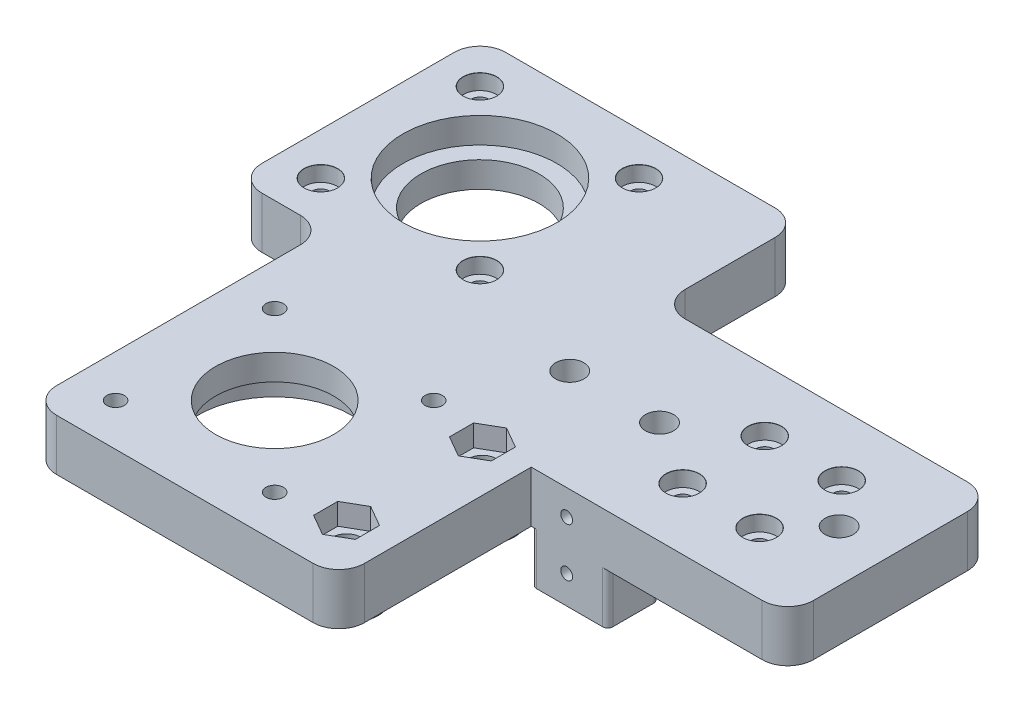
from build123d import *

# Parameters (mm, degrees)
BOSS_EXTRUDE1_DEPTH            = 10
FILLET1_R                      = 5
SKETCH3_R                      = 11.5
CUT_EXTRUDE1_DEPTH             = 10
CBORE_FOR_M3_SHCS1_AT_2_COUNT  = 2
CBORE_FOR_M3_SHCS1_AT_2_PITCH  = 43.840620434
CBORE_FOR_M3_SHCS1_AT_3_COUNT  = 2
CBORE_FOR_M3_SHCS1_AT_3_PITCH  = 31
CBORE_FOR_M3_SHCS1_AT_4_COUNT  = 2
CBORE_FOR_M3_SHCS1_AT_4_PITCH  = 31
CBORE_FOR_M3_SHCS2_AT_2_COUNT  = 2
CBORE_FOR_M3_SHCS2_AT_2_PITCH  = 15
CBORE_FOR_M3_SHCS2_AT_3_COUNT  = 2
CBORE_FOR_M3_SHCS2_AT_3_PITCH  = 21.931712199
CBORE_FOR_M3_SHCS2_AT_4_COUNT  = 2
CBORE_FOR_M3_SHCS2_AT_4_PITCH  = 16
CBORE_FOR_M5_SHCS1_AT_2_COUNT  = 2
CBORE_FOR_M5_SHCS1_AT_2_PITCH  = 35
CBORE_FOR_M5_SHCS1_AT_3_COUNT  = 2
CBORE_FOR_M5_SHCS1_AT_3_PITCH  = 52.5
BOSS_EXTRUDE2_DEPTH            = 10
CUT_EXTRUDE2_DEPTH             = 10
FILLET2_R                      = 5
SKETCH16_R                     = 11.5
CUT_EXTRUDE3_DEPTH             = 125.524094054
CBORE_FOR_M3_SHCS3_AT_2_COUNT  = 2
CBORE_FOR_M3_SHCS3_AT_2_PITCH  = 31
CBORE_FOR_M3_SHCS3_AT_3_COUNT  = 2
CBORE_FOR_M3_SHCS3_AT_3_PITCH  = 43.840620434
CBORE_FOR_M3_SHCS3_AT_4_COUNT  = 2
CBORE_FOR_M3_SHCS3_AT_4_PITCH  = 31
CUT_EXTRUDE4_DEPTH             = 4.2
M5_CLEARANCE_HOLE1_D           = 5.5
M5_CLEARANCE_HOLE1_CSINK_D     = 5.55
M5_CLEARANCE_HOLE1_CSINK_ANGLE = 90
SKETCH24_R                     = 15
CUT_EXTRUDE5_DEPTH             = 5
SKETCH25_R                     = 15
CUT_EXTRUDE6_DEPTH             = 5
BOSS_EXTRUDE3_START            = 2.9
SKETCH26_R                     = 6.25
SKETCH26_R_2                   = 2.75
BOSS_EXTRUDE3_DEPTH            = 2.9
CUT_EXTRUDE7_DEPTH             = 10
FILLET3_R                      = 5
SKETCH28_W                     = 14.9
SKETCH28_H                     = 10
BOSS_EXTRUDE4_DEPTH            = 10
SKETCH29_R                     = 1.15
CUT_EXTRUDE8_DEPTH             = 5
FILLET4_R                      = 1


with BuildPart() as part:
    # Sketch1 → Boss-Extrude1 (new body)
    with BuildSketch(Plane(origin=(0, 0, 0), x_dir=(1, 0, 0), z_dir=(0, 1, 0))):
        Polygon((0, 67.5), (0, -47.5), (60, -47.5), (60, -10), (110, -10), (110, 30), (60, 30), (60, 67.5), align=None)
    extrude(amount=BOSS_EXTRUDE1_DEPTH)

    # Fillet1
    fillet1_edges = [part.edges().sort_by_distance(p)[0] for p in [
        (60, 5, -30),
        (110, 5, -30),
        (110, 5, 10),
        (0, 5, 47.5),
        (0, 5, -67.5),
        (60, 5, -67.5),
        (60, 5, 47.5),
    ]]
    fillet(fillet1_edges, radius=FILLET1_R)

    # Sketch3 → Cut-Extrude1 (cut)
    with BuildSketch(Plane(origin=(0, 10, 0), x_dir=(1, 0, 0), z_dir=(0, 1, 0))):
        with Locations((23.75, -23.75)):
            Circle(SKETCH3_R)
    extrude(amount=-CUT_EXTRUDE1_DEPTH, mode=Mode.SUBTRACT)

    # Sketch6 → CBORE for M3 SHCS1 (revolve, cut)
    with BuildSketch(Plane(origin=(39.25, 0, 8.25), x_dir=(0, 0, -1), z_dir=(1, 0, 0))):
        Polygon((0, 0), (0, 10), (1.7, 10), (1.7, 3), (3.25, 3), (3.25, 0.025), (3.275, 0), align=None)
    cbore_for_m3_shcs1 = revolve(axis=Axis((39.25, -6.35, 8.25), (0, 1, 0)), mode=Mode.SUBTRACT)

    # CBORE for M3 SHCS1 at 2: CBORE for M3 SHCS1 ×2
    with Locations(*[Vector(-0.7071067811865478, 0, 0.7071067811865474) * (i * CBORE_FOR_M3_SHCS1_AT_2_PITCH) for i in range(1, CBORE_FOR_M3_SHCS1_AT_2_COUNT)]):
        add(cbore_for_m3_shcs1, mode=Mode.SUBTRACT)

    # CBORE for M3 SHCS1 at 3: CBORE for M3 SHCS1 ×2
    with Locations(*[(-i * CBORE_FOR_M3_SHCS1_AT_3_PITCH, 0, 0) for i in range(1, CBORE_FOR_M3_SHCS1_AT_3_COUNT)]):
        add(cbore_for_m3_shcs1, mode=Mode.SUBTRACT)

    # CBORE for M3 SHCS1 at 4: CBORE for M3 SHCS1 ×2
    with Locations(*[(0, 0, i * CBORE_FOR_M3_SHCS1_AT_4_PITCH) for i in range(1, CBORE_FOR_M3_SHCS1_AT_4_COUNT)]):
        add(cbore_for_m3_shcs1, mode=Mode.SUBTRACT)

    # Sketch9 → CBORE for M3 SHCS2 (revolve, cut)
    with BuildSketch(Plane(origin=(77.5, 10, -18), x_dir=(0, 0, 1), z_dir=(1, 0, 0))):
        Polygon((0, 0), (0, 10), (1.7, 10), (1.7, 3), (3.25, 3), (3.25, 0.025), (3.275, 0), align=None)
    cbore_for_m3_shcs2 = revolve(axis=Axis((77.5, 16.35, -18), (0, -1, 0)), mode=Mode.SUBTRACT)

    # CBORE for M3 SHCS2 at 2: CBORE for M3 SHCS2 ×2
    with Locations(*[(i * CBORE_FOR_M3_SHCS2_AT_2_PITCH, 0, 0) for i in range(1, CBORE_FOR_M3_SHCS2_AT_2_COUNT)]):
        add(cbore_for_m3_shcs2, mode=Mode.SUBTRACT)

    # CBORE for M3 SHCS2 at 3: CBORE for M3 SHCS2 ×2
    with Locations(*[Vector(0.6839411288813299, 0, 0.729537204140085) * (i * CBORE_FOR_M3_SHCS2_AT_3_PITCH) for i in range(1, CBORE_FOR_M3_SHCS2_AT_3_COUNT)]):
        add(cbore_for_m3_shcs2, mode=Mode.SUBTRACT)

    # CBORE for M3 SHCS2 at 4: CBORE for M3 SHCS2 ×2
    with Locations(*[(0, 0, i * CBORE_FOR_M3_SHCS2_AT_4_PITCH) for i in range(1, CBORE_FOR_M3_SHCS2_AT_4_COUNT)]):
        add(cbore_for_m3_shcs2, mode=Mode.SUBTRACT)

    # Sketch12 → CBORE for M5 SHCS1 (revolve, cut)
    with BuildSketch(Plane(origin=(100, 0, -10), x_dir=(0, 0, -1), z_dir=(1, 0, 0))):
        Polygon((0, 0), (0, 10), (2.75, 10), (2.75, 5), (5, 5), (5, 0.025), (5.025, 0), align=None)
    cbore_for_m5_shcs1 = revolve(axis=Axis((100, -6.35, -10), (0, 1, 0)), mode=Mode.SUBTRACT)

    # CBORE for M5 SHCS1 at 2: CBORE for M5 SHCS1 ×2
    with Locations(*[(-i * CBORE_FOR_M5_SHCS1_AT_2_PITCH, 0, 0) for i in range(1, CBORE_FOR_M5_SHCS1_AT_2_COUNT)]):
        add(cbore_for_m5_shcs1, mode=Mode.SUBTRACT)

    # CBORE for M5 SHCS1 at 3: CBORE for M5 SHCS1 ×2
    with Locations(*[(-i * CBORE_FOR_M5_SHCS1_AT_3_PITCH, 0, 0) for i in range(1, CBORE_FOR_M5_SHCS1_AT_3_COUNT)]):
        add(cbore_for_m5_shcs1, mode=Mode.SUBTRACT)

    # Sketch14 → Boss-Extrude2 (add)
    with BuildSketch(Plane(origin=(0, 10, 0), x_dir=(1, 0, 0), z_dir=(0, 1, 0))):
        with BuildLine():
            Line((0, 10), (-17.5, 10))
            Line((-17.5, 10), (-17.5, 67.5))
            Line((-17.5, 67.5), (5, 67.5))
            ThreePointArc((5, 67.5), (1.464466094, 66.035533906), (0, 62.5))
            Line((0, 62.5), (0, 10))
        make_face()
    extrude(amount=-BOSS_EXTRUDE2_DEPTH)

    # Sketch15 → Cut-Extrude2 (cut)
    with BuildSketch(Plane(origin=(0, 10, 0), x_dir=(1, 0, 0), z_dir=(0, 1, 0))):
        with BuildLine():
            Line((-17.5, 67.5), (55, 67.5))
            ThreePointArc((55, 67.5), (58.535533906, 66.035533906), (60, 62.5))
            Line((60, 62.5), (60, 57.5))
            Line((60, 57.5), (-17.5, 57.5))
            Line((-17.5, 57.5), (-17.5, 67.5))
        make_face()
    extrude(amount=-CUT_EXTRUDE2_DEPTH, mode=Mode.SUBTRACT)

    # Fillet2
    fillet2_edges = [part.edges().sort_by_distance(p)[0] for p in [
        (0, 5, -10),
        (60, 5, -57.5),
        (-17.5, 5, -57.5),
        (-17.5, 5, -10),
    ]]
    fillet(fillet2_edges, radius=FILLET2_R)

    # Sketch16 → Cut-Extrude3 (cut, through all)
    with BuildSketch(Plane(origin=(0, 10, 0), x_dir=(1, 0, 0), z_dir=(0, 1, 0))):
        with Locations((6.25, 33.75)):
            Circle(SKETCH16_R)
    extrude(amount=-CUT_EXTRUDE3_DEPTH, mode=Mode.SUBTRACT)

    # Sketch19 → CBORE for M3 SHCS3 (revolve, cut)
    with BuildSketch(Plane(origin=(-9.25, 10, -49.25), x_dir=(0, 0, 1), z_dir=(1, 0, 0))):
        Polygon((0, 0), (0, 10), (1.7, 10), (1.7, 3), (3.25, 3), (3.25, 0.025), (3.275, 0), align=None)
    cbore_for_m3_shcs3 = revolve(axis=Axis((-9.25, 16.35, -49.25), (0, -1, 0)), mode=Mode.SUBTRACT)

    # CBORE for M3 SHCS3 at 2: CBORE for M3 SHCS3 ×2
    with Locations(*[(i * CBORE_FOR_M3_SHCS3_AT_2_PITCH, 0, 0) for i in range(1, CBORE_FOR_M3_SHCS3_AT_2_COUNT)]):
        add(cbore_for_m3_shcs3, mode=Mode.SUBTRACT)

    # CBORE for M3 SHCS3 at 3: CBORE for M3 SHCS3 ×2
    with Locations(*[Vector(0.7071067811865476, 0, 0.7071067811865475) * (i * CBORE_FOR_M3_SHCS3_AT_3_PITCH) for i in range(1, CBORE_FOR_M3_SHCS3_AT_3_COUNT)]):
        add(cbore_for_m3_shcs3, mode=Mode.SUBTRACT)

    # CBORE for M3 SHCS3 at 4: CBORE for M3 SHCS3 ×2
    with Locations(*[(0, 0, i * CBORE_FOR_M3_SHCS3_AT_4_PITCH) for i in range(1, CBORE_FOR_M3_SHCS3_AT_4_COUNT)]):
        add(cbore_for_m3_shcs3, mode=Mode.SUBTRACT)

    # Sketch20 → Cut-Extrude4 (cut)
    with BuildSketch(Plane(origin=(0, 10, 0), x_dir=(1, 0, 0), z_dir=(0, 1, 0))):
        Polygon((55.070319398, -8.16), (51, -5.81), (46.929680602, -8.16), (46.929680602, -12.86), (51, -15.21), (55.070319398, -12.86), align=None)
        Polygon((51, -32.29), (46.929680602, -34.64), (46.929680602, -39.34), (51, -41.69), (55.070319398, -39.34), (55.070319398, -34.64), align=None)
    extrude(amount=-CUT_EXTRUDE4_DEPTH, mode=Mode.SUBTRACT)

    # M5 Clearance Hole1 (through all)
    with Locations(Plane(origin=(0, 10, 0), x_dir=(1, 0, 0), z_dir=(0, 1, 0))):
        with Locations((51, -10.51), (51, -36.99)):
            CounterSinkHole(M5_CLEARANCE_HOLE1_D / 2, M5_CLEARANCE_HOLE1_CSINK_D / 2, counter_sink_angle=M5_CLEARANCE_HOLE1_CSINK_ANGLE)

    # Sketch24 → Cut-Extrude5 (cut)
    with BuildSketch(Plane(origin=(0, 10, 0), x_dir=(1, 0, 0), z_dir=(0, 1, 0))):
        with Locations((6.25, 33.75)):
            Circle(SKETCH24_R)
    extrude(amount=-CUT_EXTRUDE5_DEPTH, mode=Mode.SUBTRACT)

    # Sketch25 → Cut-Extrude6 (cut)
    with BuildSketch(Plane.XZ):
        with Locations((23.75, 23.75)):
            Circle(SKETCH25_R)
    extrude(amount=-CUT_EXTRUDE6_DEPTH, mode=Mode.SUBTRACT)

    # Sketch26 → Boss-Extrude3 (add)
    # profile 1 of 2: a face of its own
    with BuildSketch(Plane.XZ.offset(BOSS_EXTRUDE3_START)):
        with Locations((51, 36.99)):
            Circle(SKETCH26_R)
        with Locations((51, 36.99)):
            Circle(SKETCH26_R_2, mode=Mode.SUBTRACT)
    # profile 2 of 2: a face of its own
    with BuildSketch(Plane.XZ.offset(BOSS_EXTRUDE3_START)):
        with Locations((51, 10.51)):
            Circle(SKETCH26_R)
        with Locations((51, 10.51)):
            Circle(SKETCH26_R_2, mode=Mode.SUBTRACT)
    extrude(amount=-BOSS_EXTRUDE3_DEPTH)

    # Sketch27 → Cut-Extrude7 (cut)
    with BuildSketch(Plane(origin=(0, 10, 0), x_dir=(1, 0, 0), z_dir=(0, 1, 0))):
        with BuildLine():
            Line((65, 30), (45, 30))
            Line((45, 30), (45, 57.5))
            Line((45, 57.5), (55, 57.5))
            ThreePointArc((55, 57.5), (58.535533906, 56.035533906), (60, 52.5))
            Line((60, 52.5), (60, 35))
            ThreePointArc((60, 35), (61.464466094, 31.464466094), (65, 30))
        make_face()
    extrude(amount=-CUT_EXTRUDE7_DEPTH, mode=Mode.SUBTRACT)

    # Fillet3
    fillet3_edges = [part.edges().sort_by_distance(p)[0] for p in [
        (45, 5, -57.5),
        (45, 5, -30),
    ]]
    fillet(fillet3_edges, radius=FILLET3_R)

    # Sketch28 → Boss-Extrude4 (add)
    with BuildSketch(Plane.XZ):
        with Locations((67.45, 5)):
            Rectangle(SKETCH28_W, SKETCH28_H)
    extrude(amount=BOSS_EXTRUDE4_DEPTH)

    # Sketch29 → Cut-Extrude8 (cut)
    with BuildSketch(Plane.XY.offset(10)):
        with Locations((66.9, 5)):
            Circle(SKETCH29_R)
        with Locations((66.9, -4.5)):
            Circle(SKETCH29_R)
    extrude(amount=-CUT_EXTRUDE8_DEPTH, mode=Mode.SUBTRACT)

    # Fillet4
    fillet4_edges = [part.edges().sort_by_distance(p)[0] for p in [
        (60, -5, 0),
        (74.9, -5, 0),
        (74.9, -5, 10),
        (60, -5, 10),
    ]]
    fillet(fillet4_edges, radius=FILLET4_R)


solid = part.part
